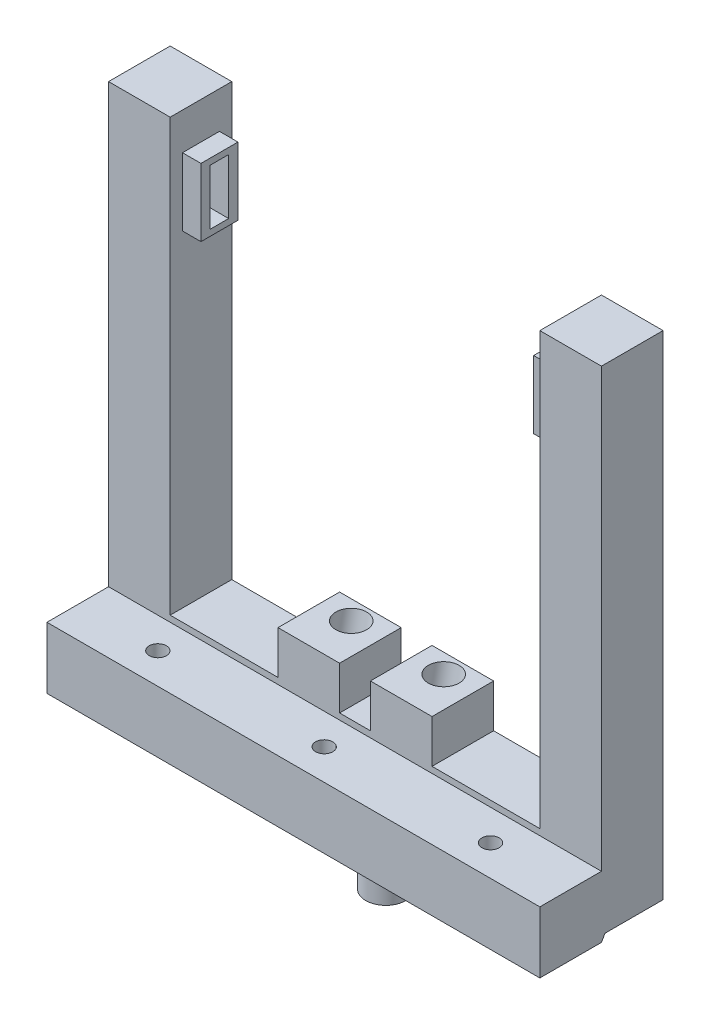
from build123d import *

# Parameters (mm, degrees)
BOSS_EXTRUDE1_DEPTH       = 10
SKETCH6_W                 = 4
SKETCH6_H                 = 9
CUT_EXTRUDE3_DEPTH        = 3
SKETCH6_3_W               = 6
SKETCH6_3_H               = 11
SKETCH6_3_W_2             = 4
SKETCH6_3_H_2             = 9
BOSS_EXTRUDE4_DEPTH       = 3
CUT_EXTRUDE4_START        = 65
CUT_EXTRUDE4_OUTLINE_W    = 4
CUT_EXTRUDE4_OUTLINE_H    = 3
CUT_EXTRUDE4_DEPTH        = 9
SKETCH5_3_W               = 6
SKETCH5_3_H               = 11
SKETCH5_3_W_2             = 3
SKETCH5_3_H_2             = 9
BOSS_EXTRUDE5_DEPTH       = 3
SKETCH8_W                 = 10
SKETCH8_H                 = 10
BOSS_EXTRUDE8_DEPTH       = 80
SKETCH9_R                 = 1.4
CUT_EXTRUDE6_DEPTH        = 10
SKETCH4_W                 = 10
SKETCH4_H                 = 10
BOSS_EXTRUDE11_DEPTH      = 7
SKETCH4_15_R              = 2.5
CUT_EXTRUDE8_DEPTH        = 8
CUT_EXTRUDE8_DEPTH_BACK   = 3
CUT_EXTRUDE11_DEPTH       = 78
SKETCH17_W                = 6
SKETCH17_H                = 6
CUT_EXTRUDE12_DEPTH       = 70
BOSS_EXTRUDE20_DEPTH      = 2
BOSS_EXTRUDE22_DEPTH      = 2
BOSS_EXTRUDE23_DEPTH      = 6
SKETCH22_W                = 10
SKETCH22_H                = 1
CUT_EXTRUDE15_DEPTH       = 80
CHAMFER3_SIZE2            = 0.577350269
CHAMFER3_SIZE             = 1
BOSS_EXTRUDE25_DEPTH      = 15
BOSS_EXTRUDE25_DEPTH_BACK = 2
CUT_EXTRUDE16_DEPTH       = 2
BOSS_EXTRUDE26_DEPTH      = 4


# Read off the part's stored shape, not the designer's step: Cut-Extrude4
with BuildPart() as part:
    # Sketch1 → Boss-Extrude1 (new body)
    with BuildSketch(Plane.XY):
        Polygon((0, 0), (80, 0), (80, 81), (70, 81), (70, 11), (10, 11), (10, 81), (0, 81), align=None)
    extrude(amount=BOSS_EXTRUDE1_DEPTH)

    # Sketch6 → Cut-Extrude3 (cut)
    with BuildSketch(Plane.ZY.offset(-70)):
        with Locations((5, 69.5)):
            Rectangle(SKETCH6_W, SKETCH6_H)
    extrude(amount=-CUT_EXTRUDE3_DEPTH, mode=Mode.SUBTRACT)

    # Sketch6<3> → Boss-Extrude4 (add)
    with BuildSketch(Plane.ZY.offset(-70)):
        with Locations((5, 69.5)):
            Rectangle(SKETCH6_3_W, SKETCH6_3_H)
        with Locations((5, 69.5)):
            Rectangle(SKETCH6_3_W_2, SKETCH6_3_H_2, mode=Mode.SUBTRACT)
    extrude(amount=BOSS_EXTRUDE4_DEPTH)

    # Cut-Extrude4 outline → Cut-Extrude4 (cut)
    with BuildSketch(Plane(origin=(0, 0, 0), x_dir=(1, 0, 0), z_dir=(0, 1, 0)).offset(CUT_EXTRUDE4_START)):
        with Locations((8, -5)):
            Rectangle(CUT_EXTRUDE4_OUTLINE_W, CUT_EXTRUDE4_OUTLINE_H)
    extrude(amount=CUT_EXTRUDE4_DEPTH, mode=Mode.SUBTRACT)

    # Sketch5<3> → Boss-Extrude5 (add)
    with BuildSketch(Plane(origin=(10, 0, 0), x_dir=(0, 0, -1), z_dir=(1, 0, 0))):
        with Locations((-5, 69.5)):
            Rectangle(SKETCH5_3_W, SKETCH5_3_H)
        with Locations((-5, 69.5)):
            Rectangle(SKETCH5_3_W_2, SKETCH5_3_H_2, mode=Mode.SUBTRACT)
    extrude(amount=BOSS_EXTRUDE5_DEPTH)

    # Sketch8 → Boss-Extrude8 (add)
    with BuildSketch(Plane(origin=(80, 0, 0), x_dir=(0, 0, -1), z_dir=(1, 0, 0))):
        with Locations((-15, 5)):
            Rectangle(SKETCH8_W, SKETCH8_H)
    extrude(amount=-BOSS_EXTRUDE8_DEPTH)

    # Sketch9 → Cut-Extrude6 (cut)
    with BuildSketch(Plane.XZ):
        with Locations(Location((40, 15, 0), (0, 0, 270))):
            Circle(SKETCH9_R)
        with Locations(Location((13, 15, 0), (0, 0, 270))):
            Circle(SKETCH9_R)
        with Locations(Location((67, 15, 0), (0, 0, 270))):
            Circle(SKETCH9_R)
    extrude(amount=-CUT_EXTRUDE6_DEPTH, mode=Mode.SUBTRACT)

    # Sketch4 → Boss-Extrude11 (add)
    with BuildSketch(Plane(origin=(0, 11, 0), x_dir=(1, 0, 0), z_dir=(0, 1, 0))):
        with Locations((32.5, -5)):
            Rectangle(SKETCH4_W, SKETCH4_H)
        with Locations((47.5, -5)):
            Rectangle(SKETCH4_W, SKETCH4_H)
    extrude(amount=BOSS_EXTRUDE11_DEPTH)

    # Sketch4<15> → Cut-Extrude8 (cut, two sides, along a direction that is not the sketch's normal)
    with BuildSketch(Plane(origin=(0, 11, 0), x_dir=(1, 0, 0), z_dir=(0, 1, 0))) as cut_extrude8_sk:
        with Locations((32.5, -4.5)):
            Circle(SKETCH4_15_R)
        with Locations((47.5, -4.5)):
            Circle(SKETCH4_15_R)
    extrude(amount=CUT_EXTRUDE8_DEPTH, dir=(0, 0.9807170231588296, -0.19543316117405435), mode=Mode.SUBTRACT)
    extrude(cut_extrude8_sk.sketch, amount=-CUT_EXTRUDE8_DEPTH_BACK, dir=(0, 0.9807170231588296, -0.19543316117405435), mode=Mode.SUBTRACT)

    # Sketch2 → Cut-Extrude11 (cut)
    with BuildSketch(Plane.ZY):
        with BuildLine():
            Line((8, 8), (5, 8))
            ThreePointArc((5, 8), (7.121320344, 7.121320344), (8, 5))
            Line((8, 5), (8, 8))
        make_face()
        with BuildLine():
            Line((8, 2), (8, 5))
            ThreePointArc((8, 5), (7.121320344, 2.878679656), (5, 2))
            Line((5, 2), (8, 2))
        make_face()
        with BuildLine():
            ThreePointArc((5, 2), (2.878679656, 2.878679656), (2, 5))
            Line((2, 5), (2, 2))
            Line((2, 2), (5, 2))
        make_face()
        with BuildLine():
            ThreePointArc((2, 5), (2.878679656, 7.121320344), (5, 8))
            Line((5, 8), (2, 8))
            Line((2, 8), (2, 5))
        make_face()
        with BuildLine():
            ThreePointArc((8, 5), (7.121320344, 7.121320344), (5, 8))
            Line((5, 8), (5, 7))
            ThreePointArc((5, 7), (6.414213562, 6.414213562), (7, 5))
            ThreePointArc((7, 5), (6.414213562, 3.585786438), (5, 3))
            Line((5, 3), (5, 2))
            ThreePointArc((5, 2), (7.121320344, 2.878679656), (8, 5))
        make_face()
        with BuildLine():
            Line((5, 7), (5, 8))
            ThreePointArc((5, 8), (2.878679656, 7.121320344), (2, 5))
            ThreePointArc((2, 5), (2.878679656, 2.878679656), (5, 2))
            Line((5, 2), (5, 3))
            ThreePointArc((5, 3), (3, 5), (5, 7))
        make_face()
        with BuildLine():
            ThreePointArc((7, 5), (6.414213562, 6.414213562), (5, 7))
            Line((5, 7), (5, 3))
            ThreePointArc((5, 3), (6.414213562, 3.585786438), (7, 5))
        make_face()
        with BuildLine():
            Line((5, 3), (5, 7))
            ThreePointArc((5, 7), (3, 5), (5, 3))
        make_face()
    extrude(amount=-CUT_EXTRUDE11_DEPTH, mode=Mode.SUBTRACT)

    # Sketch17 → Cut-Extrude12 (cut)
    with BuildSketch(Plane.XZ.offset(-8)):
        with Locations((5, 5)):
            Rectangle(SKETCH17_W, SKETCH17_H)
        with Locations((75, 5)):
            Rectangle(SKETCH17_W, SKETCH17_H)
    extrude(amount=-CUT_EXTRUDE12_DEPTH, mode=Mode.SUBTRACT)

    # Sketch2<17> → Boss-Extrude20 (add)
    with BuildSketch(Plane.ZY):
        with BuildLine():
            ThreePointArc((2, 5), (2.878679656, 7.121320344), (5, 8))
            Line((5, 8), (2, 8))
            Line((2, 8), (2, 5))
        make_face()
        with BuildLine():
            Line((8, 8), (5, 8))
            ThreePointArc((5, 8), (7.121320344, 7.121320344), (8, 5))
            Line((8, 5), (8, 8))
        make_face()
        with BuildLine():
            Line((8, 2), (8, 5))
            ThreePointArc((8, 5), (7.121320344, 2.878679656), (5, 2))
            Line((5, 2), (8, 2))
        make_face()
        with BuildLine():
            ThreePointArc((5, 2), (2.878679656, 2.878679656), (2, 5))
            Line((2, 5), (2, 2))
            Line((2, 2), (5, 2))
        make_face()
    extrude(amount=-BOSS_EXTRUDE20_DEPTH)

    # Sketch2<18> → Boss-Extrude22 (add)
    with BuildSketch(Plane.ZY):
        with BuildLine():
            ThreePointArc((8, 5), (7.121320344, 7.121320344), (5, 8))
            Line((5, 8), (5, 7))
            ThreePointArc((5, 7), (6.414213562, 6.414213562), (7, 5))
            ThreePointArc((7, 5), (6.414213562, 3.585786438), (5, 3))
            Line((5, 3), (5, 2))
            ThreePointArc((5, 2), (7.121320344, 2.878679656), (8, 5))
        make_face()
        with BuildLine():
            Line((5, 7), (5, 8))
            ThreePointArc((5, 8), (2.878679656, 7.121320344), (2, 5))
            ThreePointArc((2, 5), (2.878679656, 2.878679656), (5, 2))
            Line((5, 2), (5, 3))
            ThreePointArc((5, 3), (3, 5), (5, 7))
        make_face()
        with BuildLine():
            ThreePointArc((7, 5), (6.414213562, 6.414213562), (5, 7))
            Line((5, 7), (5, 3))
            ThreePointArc((5, 3), (6.414213562, 3.585786438), (7, 5))
        make_face()
        with BuildLine():
            Line((5, 3), (5, 7))
            ThreePointArc((5, 7), (3, 5), (5, 3))
        make_face()
    extrude(amount=-BOSS_EXTRUDE22_DEPTH)

    # Sketch21 → Boss-Extrude23 (add)
    with BuildSketch(Plane.XY.offset(2)):
        Polygon((41.4, 8.008887831), (38.6, 8), (40, 5), align=None)
    extrude(amount=BOSS_EXTRUDE23_DEPTH)

    # Sketch22 → Cut-Extrude15 (cut)
    with BuildSketch(Plane(origin=(80, 0, 0), x_dir=(0, 0, -1), z_dir=(1, 0, 0))):
        with Locations((-5, 0.5)):
            Rectangle(SKETCH22_W, SKETCH22_H)
    extrude(amount=-CUT_EXTRUDE15_DEPTH, mode=Mode.SUBTRACT)

    # Chamfer3
    chamfer3_edges = [part.edges().sort_by_distance(p)[0] for p in [
        (40, 1, 10),
    ]]
    chamfer3_side = [part.faces().sort_by_distance(p)[0] for p in [
        (40, 0.988452995, 10),
    ]]
    chamfer(chamfer3_edges, length=CHAMFER3_SIZE - 0.0001, length2=CHAMFER3_SIZE2 - 0.0001, reference=chamfer3_side[0])  # a hair under: the kernel refuses the full size

    # Sketch19<5> → Cut-Extrude16 (cut)
    with BuildSketch(Plane.XZ):
        with BuildLine():
            ThreePointArc((40, 7.25), (37.75, 5), (40, 2.75))
            Line((40, 2.75), (40, 7.25))
        make_face()
        with BuildLine():
            Line((40, 7.25), (40, 2.75))
            ThreePointArc((40, 2.75), (41.590990258, 3.409009742), (42.25, 5))
            ThreePointArc((42.25, 5), (41.590990258, 6.590990258), (40, 7.25))
        make_face()
    extrude(amount=-CUT_EXTRUDE16_DEPTH, mode=Mode.SUBTRACT)

    # Sketch4<16> → Boss-Extrude26 (add, along a direction that is not the sketch's normal)
    with BuildSketch(Plane(origin=(0, 11, 0), x_dir=(1, 0, 0), z_dir=(0, 1, 0))):
        with BuildLine():
            Line((30.47865802, -3.028885933), (30.47865802, -1.642697671))
            ThreePointArc((30.47865802, -1.642697671), (29, -4.5), (30.47865802, -7.357302329))
            Line((30.47865802, -7.357302329), (30.47865802, -5.971114067))
            ThreePointArc((30.47865802, -5.971114067), (30, -4.5), (30.47865802, -3.028885933))
        make_face()
        with BuildLine():
            ThreePointArc((49.52134198, -7.357302329), (51, -4.5), (49.52134198, -1.642697671))
            Line((49.52134198, -1.642697671), (49.52134198, -3.028885933))
            ThreePointArc((49.52134198, -3.028885933), (50, -4.5), (49.52134198, -5.971114067))
            Line((49.52134198, -5.971114067), (49.52134198, -7.357302329))
        make_face()
    extrude(amount=-BOSS_EXTRUDE26_DEPTH, dir=(0, 0.9807170231588296, -0.19543316117405435))


with BuildPart() as body_2:
    # Sketch19 → Boss-Extrude25 (new, two sides: drawn at the far end of the back side and taken through both)
    with BuildSketch(Plane.XZ.offset(-BOSS_EXTRUDE25_DEPTH_BACK)):
        with BuildLine():
            ThreePointArc((40, 8.25), (36.75, 5), (40, 1.75))
            Line((40, 1.75), (40, 2.75))
            ThreePointArc((40, 2.75), (37.75, 5), (40, 7.25))
            Line((40, 7.25), (40, 8.25))
        make_face()
        with BuildLine():
            Line((40, 2.75), (40, 1.75))
            ThreePointArc((40, 1.75), (42.298097039, 2.701902961), (43.25, 5))
            ThreePointArc((43.25, 5), (42.298097039, 7.298097039), (40, 8.25))
            Line((40, 8.25), (40, 7.25))
            ThreePointArc((40, 7.25), (41.590990258, 6.590990258), (42.25, 5))
            ThreePointArc((42.25, 5), (41.590990258, 3.409009742), (40, 2.75))
        make_face()
    extrude(amount=BOSS_EXTRUDE25_DEPTH + BOSS_EXTRUDE25_DEPTH_BACK)


solid = Compound([part.part, body_2.part])
